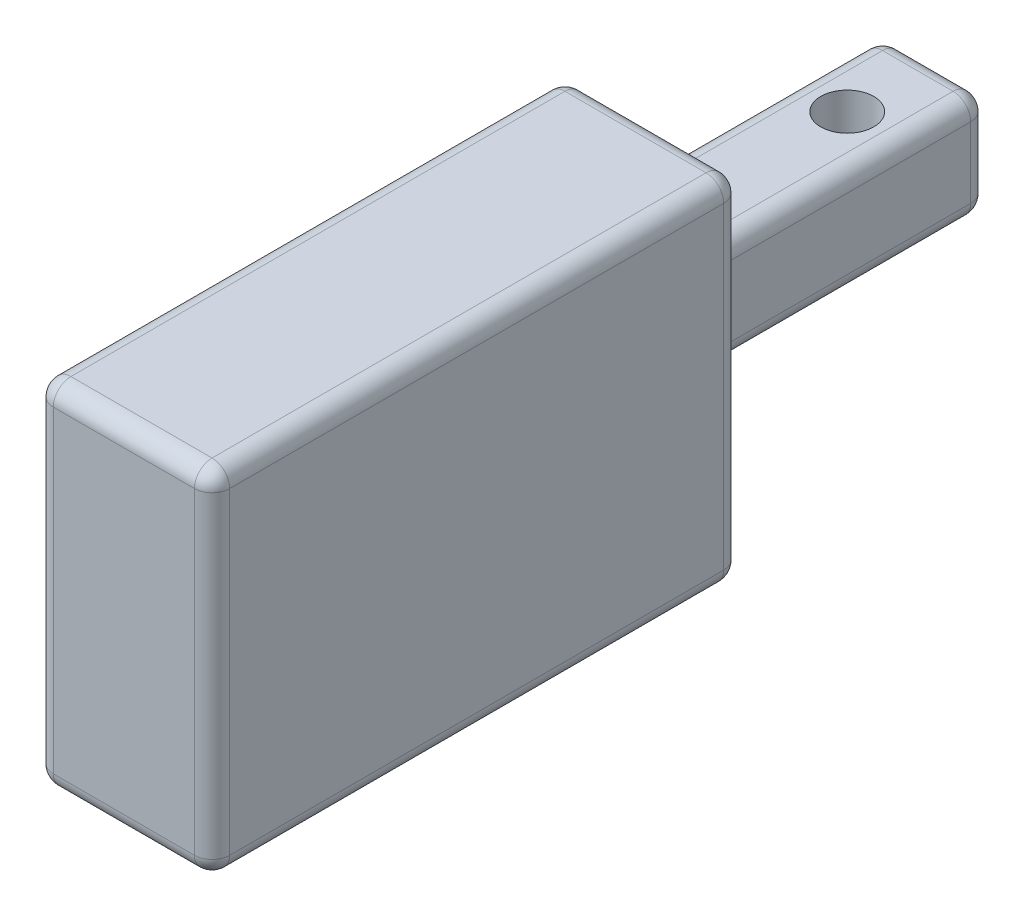
from build123d import *

# Parameters (mm, degrees)
SKETCH_1_W          = 10
SKETCH_1_H          = 22
EXTRUDE_1_DEPTH     = 30
SKETCH_2_W          = 6
SKETCH_2_H          = 6
EXTRUDE_3_DEPTH     = 14
SKETCH_3_R          = 1.5
CUT_EXTRUDE_1_DEPTH = 6
SKETCH_6_W          = 10
SKETCH_6_H          = 30
CUT_EXTRUDE_2_DEPTH = 2
SKETCH_7_W          = 6
SKETCH_7_H          = 6
EXTRUDE_4_DEPTH     = 2
SKETCH_8_R          = 1
CUT_EXTRUDE_3_DEPTH = 4
FILLET_1_R          = 1


with BuildPart() as part:
    # 草图1 → 凸台-拉伸1 (new body)
    with BuildSketch(Plane.XY):
        with Locations((5, 11)):
            Rectangle(SKETCH_1_W, SKETCH_1_H)
    extrude(amount=EXTRUDE_1_DEPTH)

    # 草图2 → 凸台-拉伸3 (add)
    with BuildSketch(Plane.XY):
        with Locations((5, 12)):
            Rectangle(SKETCH_2_W, SKETCH_2_H)
    extrude(amount=-EXTRUDE_3_DEPTH)

    # 草图3 → 切除-拉伸1 (cut)
    with BuildSketch(Plane(origin=(0, 9, 0), x_dir=(-1, 0, 0), z_dir=(0, -1, 0))):
        with Locations(Location((-5, 11, 0), (0, 0, 90))):
            Circle(SKETCH_3_R)
    extrude(amount=-CUT_EXTRUDE_1_DEPTH, mode=Mode.SUBTRACT)

    # 草图6 → 切除-拉伸2 (cut)
    with BuildSketch(Plane(origin=(0, 22, 0), x_dir=(1, 0, 0), z_dir=(0, 1, 0))):
        with Locations((5, -15)):
            Rectangle(SKETCH_6_W, SKETCH_6_H)
    extrude(amount=-CUT_EXTRUDE_2_DEPTH, mode=Mode.SUBTRACT)

    # 草图7 → 凸台-拉伸4 (add)
    with BuildSketch(Plane(origin=(0, 0, -14), x_dir=(-1, 0, 0), z_dir=(0, 0, -1))):
        with Locations((-5, 12)):
            Rectangle(SKETCH_7_W, SKETCH_7_H)
    extrude(amount=EXTRUDE_4_DEPTH)

    # 草图8 → 切除-拉伸3 (cut)
    with BuildSketch(Plane(origin=(0, 0, -16), x_dir=(-1, 0, 0), z_dir=(0, 0, -1))):
        with Locations((-5, 12)):
            Circle(SKETCH_8_R)
    extrude(amount=-CUT_EXTRUDE_3_DEPTH, mode=Mode.SUBTRACT)

    # 圆角1
    fillet_1_edges = [part.edges().sort_by_distance(p)[0] for p in [
        (10, 10, 30),
        (2, 9, -8),
        (2, 15, -8),
        (8, 15, -8),
        (8, 9, -8),
        (2, 12, 0),
        (5, 9, 0),
        (8, 12, 0),
        (5, 15, 0),
        (0, 10, 30),
        (0, 10, 0),
        (0, 20, 15),
        (5, 20, 0),
        (10, 20, 15),
        (5, 20, 30),
        (2, 12, -16),
        (5, 15, -16),
        (8, 12, -16),
        (5, 9, -16),
        (10, 10, 0),
        (5, 0, 0),
        (10, 0, 15),
        (0, 0, 15),
        (5, 0, 30),
    ]]
    fillet(fillet_1_edges, radius=FILLET_1_R - 0.0001)  # a hair under: the kernel refuses the full size


solid = part.part
